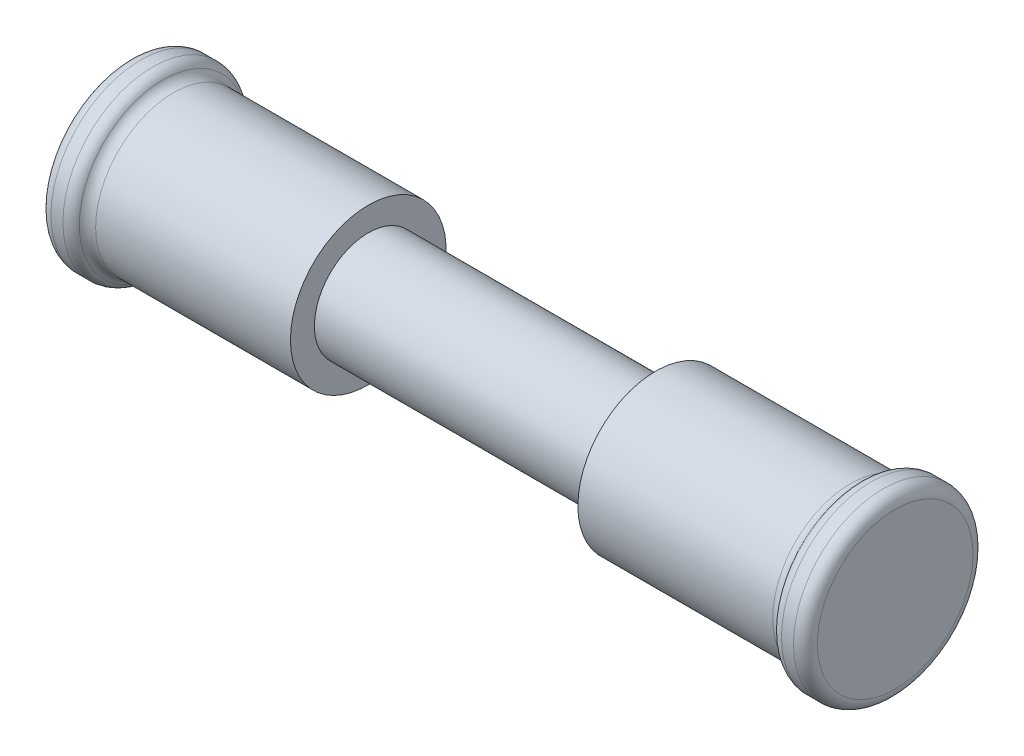
from build123d import *

# Parameters (mm, degrees)
SKETCH1_R            = 2.25
BOSS_EXTRUDE1_DEPTH  = 6
SKETCH2_R            = 3.25
BOSS_EXTRUDE2_DEPTH  = 10
SKETCH3_R            = 3.75
BOSS_EXTRUDE3_DEPTH  = 1.5
FILLET1_R            = 0.5
FILLET2_R            = 0.5
FILLET1_OF_MIRROR1_R = 0.5
FILLET2_OF_MIRROR1_R = 0.5


with BuildPart() as part:
    # Sketch1 → Boss-Extrude1 (new, symmetric)
    with BuildSketch(Plane(origin=(0, 0, 0), x_dir=(0, 0, -1), z_dir=(1, 0, 0))):
        Circle(SKETCH1_R)
    extrude(amount=BOSS_EXTRUDE1_DEPTH, both=True)

    # Sketch2 → Boss-Extrude2 (add)
    with BuildSketch(Plane.ZY.offset(6)):
        Circle(SKETCH2_R)
    boss_extrude2 = extrude(amount=BOSS_EXTRUDE2_DEPTH)

    # Sketch3 → Boss-Extrude3 (add)
    with BuildSketch(Plane.ZY.offset(16)):
        Circle(SKETCH3_R)
    boss_extrude3 = extrude(amount=-BOSS_EXTRUDE3_DEPTH)

    # Fillet1
    fillet1_edges = [part.edges().sort_by_distance(p)[0] for p in [
        (-14.5, 0, -3.75),
        (-16, 0, -3.75),
    ]]
    fillet(fillet1_edges, radius=FILLET1_R - 0.0001)  # a hair under: the kernel refuses the full size

    # Fillet2
    fillet2_edges = [part.edges().sort_by_distance(p)[0] for p in [
        (-14.5, 0, -3.25),
    ]]
    fillet(fillet2_edges, radius=FILLET2_R)

    # Mirror1: Boss-Extrude2, Boss-Extrude3 across plane
    add(boss_extrude2.mirror(Plane(origin=(0, 0, 0), x_dir=(0, 0, 1), z_dir=(1, 0, 0))))
    add(boss_extrude3.mirror(Plane(origin=(0, 0, 0), x_dir=(0, 0, 1), z_dir=(1, 0, 0))))

    # Fillet1 of Mirror1
    fillet1_of_mirror1_edges = [part.edges().sort_by_distance(p)[0] for p in [
        (14.5, 0, -3.75),
        (16, 0, -3.75),
    ]]
    fillet(fillet1_of_mirror1_edges, radius=FILLET1_OF_MIRROR1_R - 0.0001)  # a hair under: the kernel refuses the full size

    # Fillet2 of Mirror1
    fillet2_of_mirror1_edges = [part.edges().sort_by_distance(p)[0] for p in [
        (14.5, 0, -3.25),
    ]]
    fillet(fillet2_of_mirror1_edges, radius=FILLET2_OF_MIRROR1_R)


solid = part.part
